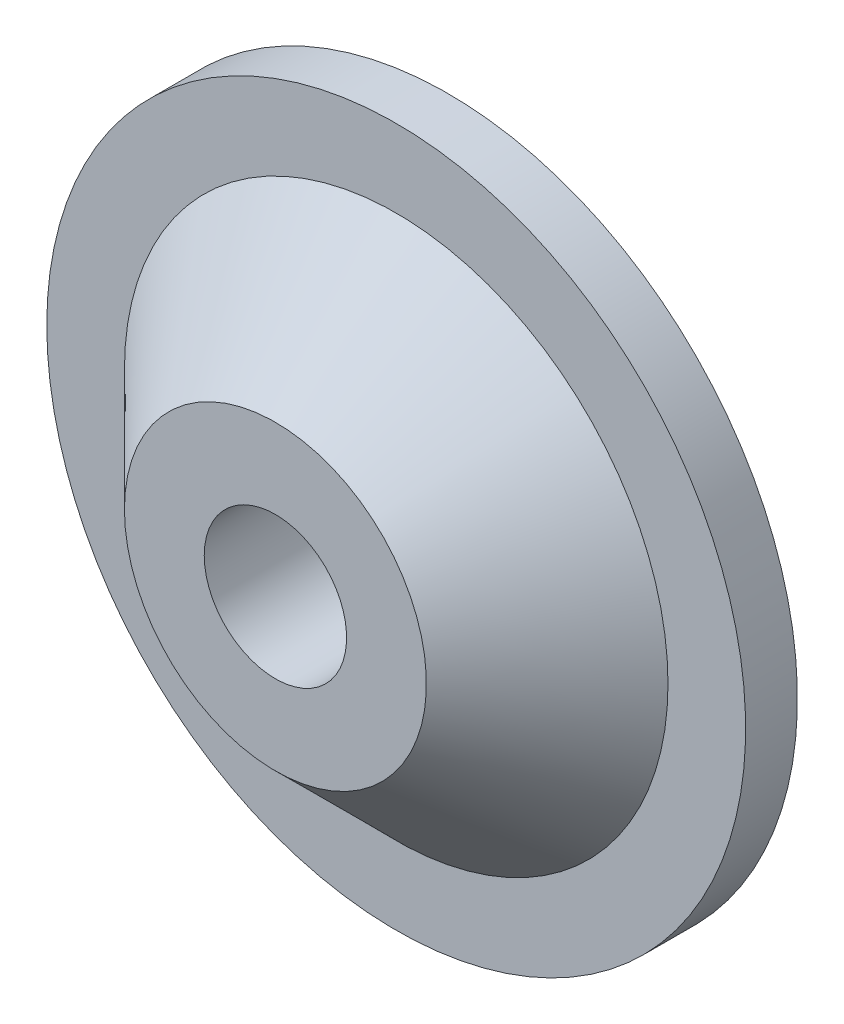
from build123d import *


with BuildPart() as part:
    # Sketch3 → Revolve1 (revolve)
    with BuildSketch(Plane(origin=(0, 0, 0), x_dir=(1, 0, 0), z_dir=(0, 1, 0))):
        Polygon((3.5, -2.8), (6.3, 0), (8.1, 0), (8.1, 1.2), (1.65, 1.2), (1.65, 0), (1.65, -2.8), align=None)
    revolve(axis=Axis((0, 0, -35.580076817), (0, 0, 1)))


solid = part.part
